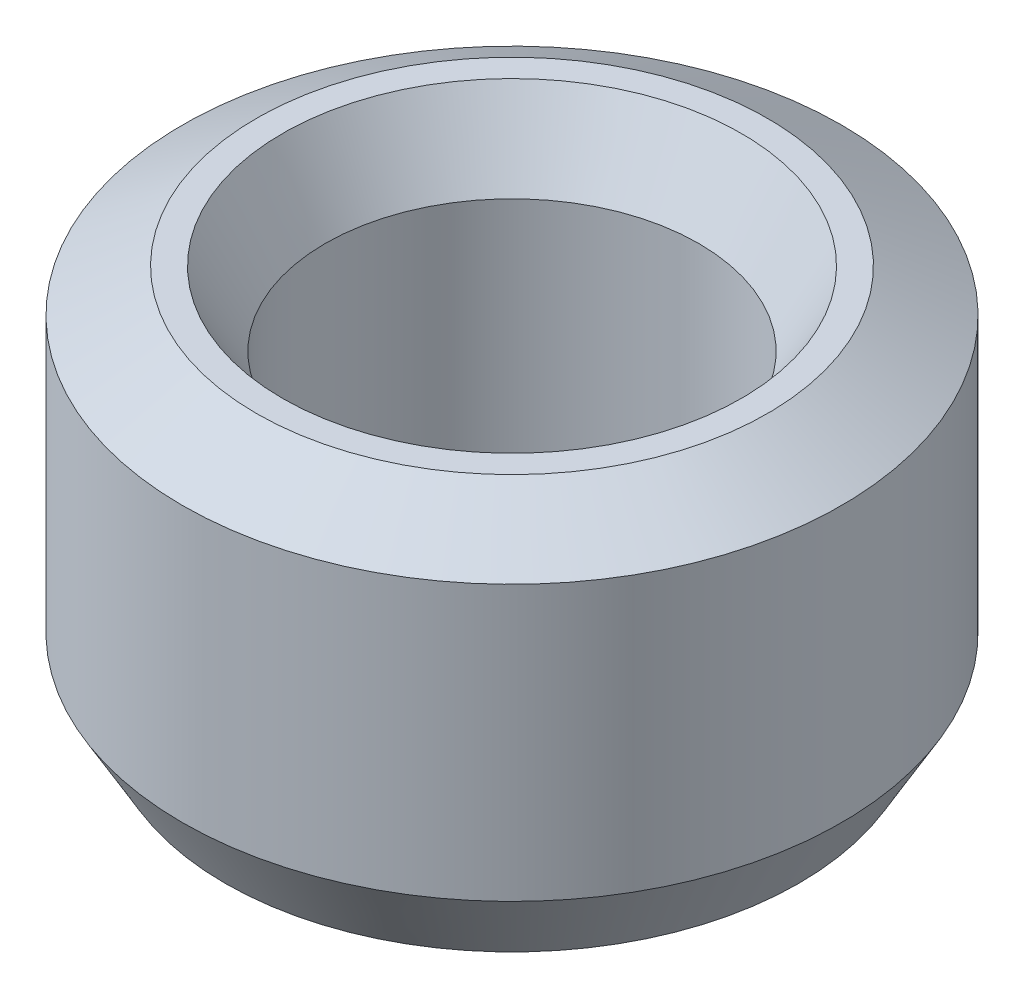
from build123d import *
from OCP.BRepFilletAPI import BRepFilletAPI_MakeChamfer

# Parameters (mm, degrees)
SKETCH1_R           = 17.5
BOSS_EXTRUDE1_DEPTH = 20.779112964
SKETCH2_R           = 9.918949932
CUT_EXTRUDE1_DEPTH  = 33.315190477
CHAMFER1_SIZE       = 2.267048354
CHAMFER1_SIZE2      = 3.926642933


with BuildPart() as part:
    # Sketch1 → Boss-Extrude1 (new body)
    with BuildSketch(Plane(origin=(0, 0, 0), x_dir=(1, 0, 0), z_dir=(0, 1, 0))):
        Circle(SKETCH1_R)
    extrude(amount=BOSS_EXTRUDE1_DEPTH)

    # Sketch2 → Cut-Extrude1 (cut, through all)
    with BuildSketch(Plane(origin=(0, 0, 0), x_dir=(1, 0, 0), z_dir=(0, 1, 0))):
        Circle(SKETCH2_R)
    extrude(amount=CUT_EXTRUDE1_DEPTH, mode=Mode.SUBTRACT)

    # Chamfer1: one chamfer whose edges measure the first distance from different faces: ONE call of the kernel's chamfer builder (chamfer() names one face for all edges)
    chamfer1_edges_1 = [part.edges().sort_by_distance(p)[0] for p in [
        (-9.918949932, 20.779112964, 0),
    ]]
    chamfer1_side_1 = [part.faces().sort_by_distance(p)[0] for p in [
        (-17.005025253, 20.779112964, 0),
    ]]
    chamfer1_edges_2 = [part.edges().sort_by_distance(p)[0] for p in [
        (-9.918949932, 0, 0),
    ]]
    chamfer1_side_2 = [part.faces().sort_by_distance(p)[0] for p in [
        (-9.918949932, 10.389556482, 0),
    ]]
    chamfer1_edges_3 = [part.edges().sort_by_distance(p)[0] for p in [
        (-17.5, 0, 0),
    ]]
    chamfer1_side_3 = [part.faces().sort_by_distance(p)[0] for p in [
        (-17.005025253, 0, 0),
    ]]
    chamfer1_edges_4 = [part.edges().sort_by_distance(p)[0] for p in [
        (-17.5, 20.779112964, 0),
    ]]
    chamfer1_side_4 = [part.faces().sort_by_distance(p)[0] for p in [
        (-17.5, 10.389556482, 0),
    ]]
    chamfer1 = BRepFilletAPI_MakeChamfer(part.part.solid().wrapped)
    for e in chamfer1_edges_1:
        chamfer1.Add(CHAMFER1_SIZE, CHAMFER1_SIZE2, e.wrapped, chamfer1_side_1[0].wrapped)  # the first distance lies on this face
    for e in chamfer1_edges_2:
        chamfer1.Add(CHAMFER1_SIZE, CHAMFER1_SIZE2, e.wrapped, chamfer1_side_2[0].wrapped)  # the first distance lies on this face
    for e in chamfer1_edges_3:
        chamfer1.Add(CHAMFER1_SIZE, CHAMFER1_SIZE2, e.wrapped, chamfer1_side_3[0].wrapped)  # the first distance lies on this face
    for e in chamfer1_edges_4:
        chamfer1.Add(CHAMFER1_SIZE, CHAMFER1_SIZE2, e.wrapped, chamfer1_side_4[0].wrapped)  # the first distance lies on this face
    add(Compound.cast(chamfer1.Shape()), mode=Mode.REPLACE)


solid = part.part
